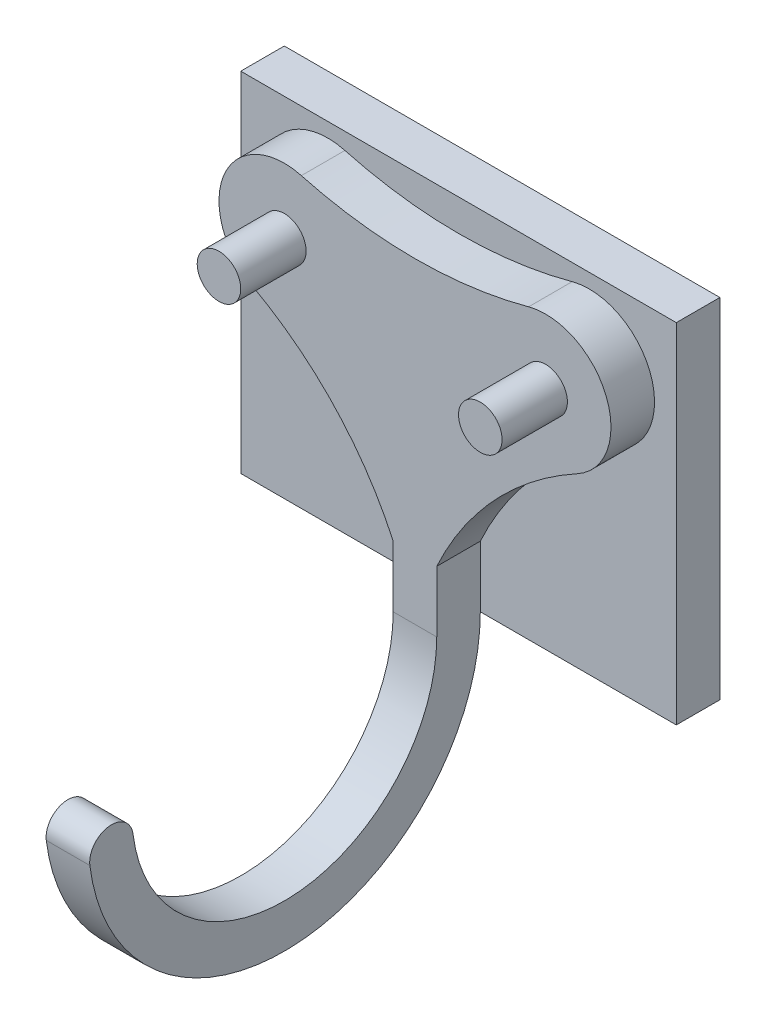
from build123d import *

# Parameters (mm, degrees)
SKETCH1_W           = 20
SKETCH1_H           = 16
BOSS_EXTRUDE1_DEPTH = 2
BOSS_EXTRUDE2_DEPTH = 2
BOSS_EXTRUDE3_DEPTH = 1
FILLET1_START       = -2
FILLET1_DEPTH       = 4
SKETCH4_R           = 1
BOSS_EXTRUDE4_DEPTH = 3


with BuildPart() as part:
    # Sketch1 → Boss-Extrude1 (new body)
    with BuildSketch(Plane.XY):
        Rectangle(SKETCH1_W, SKETCH1_H)
    extrude(amount=BOSS_EXTRUDE1_DEPTH)

    # Sketch2 → Boss-Extrude2 (add)
    with BuildSketch(Plane.XY.offset(2)):
        with BuildLine():
            Line((-1, -8), (-1, -5.19120215))
            ThreePointArc((-1, -5.19120215), (-3.662465131, -1.222418993), (-7.438132905, 1.707477453))
            ThreePointArc((-7.438132905, 1.707477453), (-8.78383647, 5.458451445), (-5.217391304, 7.236425814))
            ThreePointArc((-5.217391304, 7.236425814), (0, 6.543906954), (5.217391304, 7.236425814))
            ThreePointArc((5.217391304, 7.236425814), (8.78383647, 5.458451445), (7.438132905, 1.707477453))
            ThreePointArc((7.438132905, 1.707477453), (3.662465131, -1.222418993), (1, -5.19120215))
            Line((1, -5.19120215), (1, -8))
            Line((1, -8), (-1, -8))
        make_face()
    extrude(amount=BOSS_EXTRUDE2_DEPTH)

    # Sketch3 → Boss-Extrude3 (add, symmetric)
    with BuildSketch(Plane(origin=(0, 0, 0), x_dir=(0, 0, -1), z_dir=(1, 0, 0))):
        with BuildLine():
            Line((-4, -8), (-2, -8))
            ThreePointArc((-2, -8), (-11, -17), (-20, -8))
            Line((-20, -8), (-18, -8))
            ThreePointArc((-18, -8), (-11, -15), (-4, -8))
        make_face()
    extrude(amount=BOSS_EXTRUDE3_DEPTH, both=True)

    # Fillet1: read off the stored shape, not the designer's step
    # Fillet1 outline → Fillet1 (cut)
    with BuildSketch(Plane.YZ.offset(FILLET1_START)):
        with BuildLine():
            ThreePointArc((-8, 20), (-8.563606213, 19.982335333), (-9.125, 19.929410675))
            add(Edge.make_bspline(
                [(-9.125, 19.929410675), (-8.857196429, 19.963150753), (-8.534549287, 19.913651104), (-8.211558936, 19.723387149), (-8.000000009, 19.372242351), (-8, 18.937253953)],
                knots=[0, 0, 0, 0, 0, 0, 0.531373028, 0.531373028, 0.531373028, 0.531373028, 0.531373028, 0.531373028], degree=5, weights=[1, 0.787450789, 0.631373036, 0.531766743, 0.488631909, 0.501968534]))
            Line((-8, 18.937253953), (-8, 20))
        make_face()
        with BuildLine():
            Line((-8, 18), (-8, 18.937253953))
            add(Edge.make_bspline(
                [(-8, 18.937253953), (-7.999999993, 18.572372269), (-8.153666641, 18.269213464), (-8.39236455, 18.072074091), (-8.646114708, 17.973934028), (-8.875, 17.945097192)],
                knots=[0.531373028, 0.531373028, 0.531373028, 0.531373028, 0.531373028, 0.531373028, 1, 1, 1, 1, 1, 1], degree=5, weights=[0.501968534, 0.513730332, 0.569414377, 0.66902067, 0.812549211, 1]))
            ThreePointArc((-8.875, 17.945097192), (-8.438360388, 17.986260815), (-8, 18))
        make_face()
    extrude(amount=FILLET1_DEPTH, mode=Mode.SUBTRACT)

    # Sketch4 → Boss-Extrude4 (add)
    with BuildSketch(Plane.XY.offset(4)):
        with Locations(Location((-6, 4.340303643, 0), (0, 0, 180))):
            Circle(SKETCH4_R)
        with Locations(Location((6, 4.340303643, 0), (0, 0, 180))):
            Circle(SKETCH4_R)
    extrude(amount=BOSS_EXTRUDE4_DEPTH)


solid = part.part
